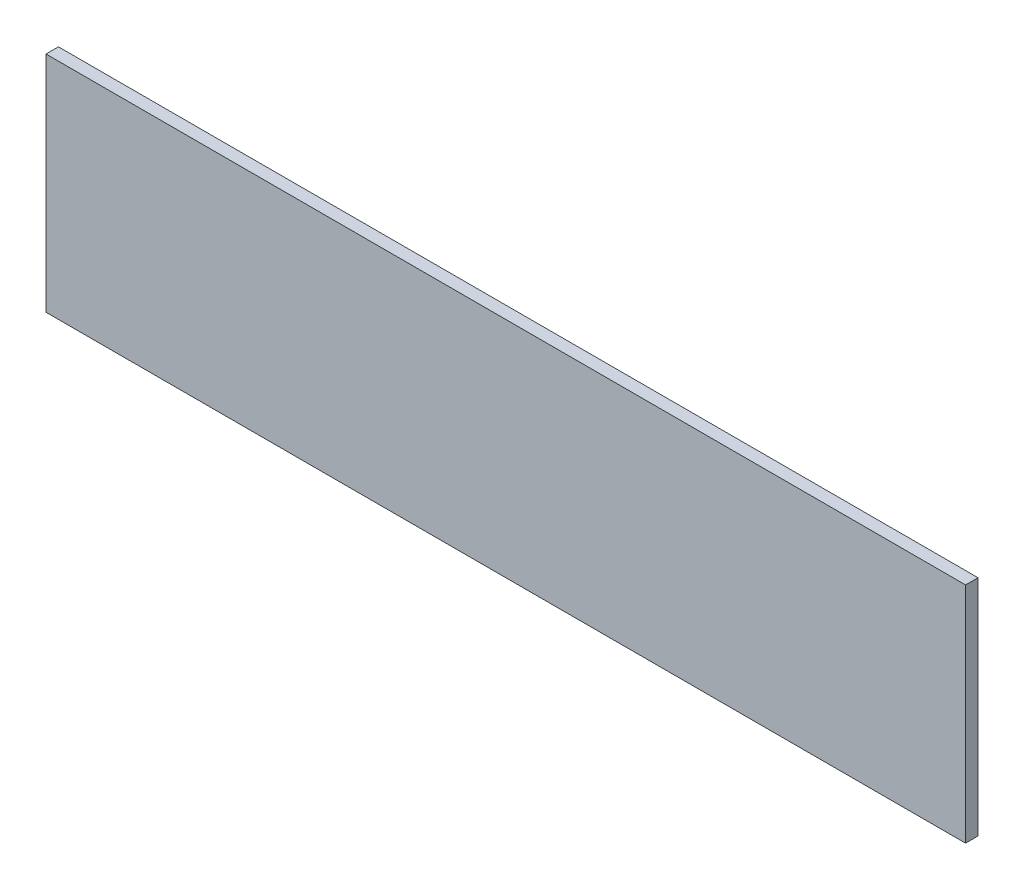
from build123d import *

# Parameters (mm, degrees)
SKETCH1_W           = 370
SKETCH1_H           = 90
BOSS_EXTRUDE1_DEPTH = 5


with BuildPart() as part:
    # Sketch1 → Boss-Extrude1 (new body)
    with BuildSketch(Plane.XY):
        Rectangle(SKETCH1_W, SKETCH1_H)
    extrude(amount=BOSS_EXTRUDE1_DEPTH)


solid = part.part
